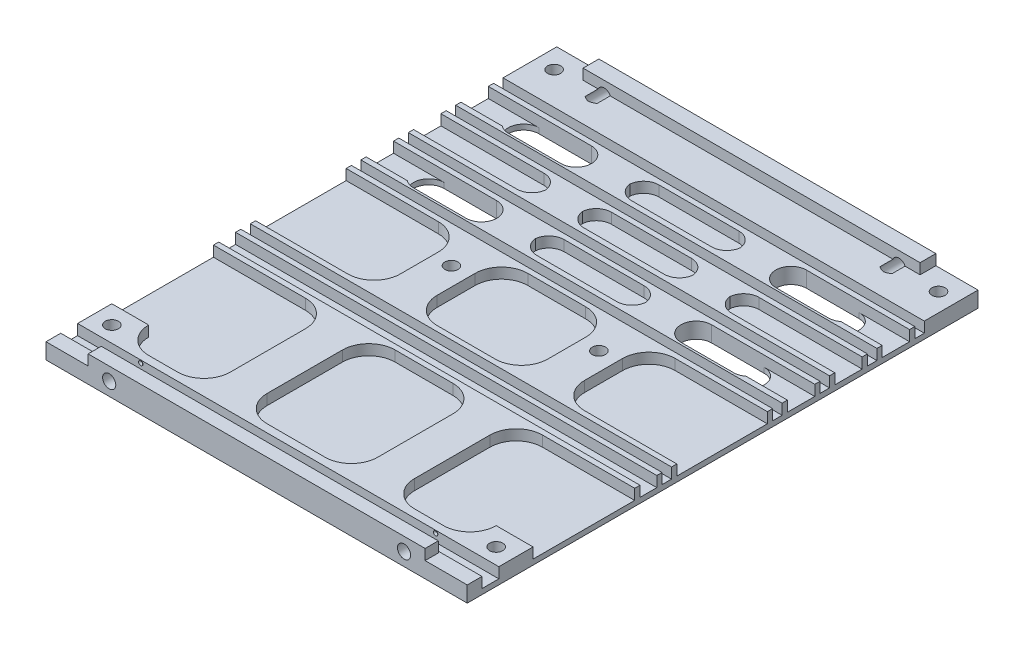
from build123d import *
from build123d.topology import SkipClean

# Parameters (mm, degrees)
SKETCH1_W                      = 80
SKETCH1_H                      = 97
BOSS_EXTRUDE1_DEPTH            = 1
SKETCH4_W                      = 80
SKETCH4_H                      = 1
BOSS_EXTRUDE2_DEPTH            = 2
LPATTERN1_COUNT                = 4
LPATTERN1_PITCH                = 9
MIRROR1_COPY_1_SKETCH_W        = 80
MIRROR1_COPY_1_SKETCH_H        = 1
MIRROR1_COPY_1_DEPTH           = 2
MIRROR1_COPY_2_SKETCH_W        = 80
MIRROR1_COPY_2_SKETCH_H        = 1
MIRROR1_COPY_2_DEPTH           = 2
MIRROR1_COPY_3_SKETCH_W        = 80
MIRROR1_COPY_3_SKETCH_H        = 1
MIRROR1_COPY_3_DEPTH           = 2
SKETCH10_W                     = 80
SKETCH10_H                     = 21.8
REMOVE_3_ROWS_DEPTH            = 63.898728127
SKETCH12_W                     = 80
SKETCH12_H                     = 1
SKETCH12_H_2                   = 1.5
PAYLOADSLOTS_DEPTH             = 2
BOSS_EXTRUDE8_DEPTH            = 2
SKETCH22_W                     = 80
SKETCH22_H                     = 9.2
SKETCH22_H_2                   = 2.5
BOSS_EXTRUDE9_DEPTH            = 4
FILLET4_R                      = 5
M3X0_5_TAPPED_HOLE2_AT_2_COUNT = 2
M3X0_5_TAPPED_HOLE2_AT_2_PITCH = 56
CUT_EXTRUDE1_REACH             = 65.065
SKETCH26_W                     = 8
SKETCH26_H                     = 2.5
SKETCH28_W                     = 7
SKETCH28_H                     = 5.2
SKETCH28_H_2                   = 24.3
BOSS_EXTRUDE10_DEPTH           = 2
FILLET5_R                      = 5
FILLET6_R                      = 2.9
SKETCH29_W                     = 7
SKETCH29_H                     = 5
BOSS_EXTRUDE11_DEPTH           = 2
FILLET7_R                      = 5
M3X0_5_TAPPED_HOLE1_D          = 2.5
CUT_EXTRUDE2_DEPTH             = 63.994047338
CUT_EXTRUDE2_DEPTH_BACK        = 63.994047338


# Some blends are built 0.0001 mm under size
with BuildPart() as part:
    # Sketch1 → Boss-Extrude1 (new body)
    with BuildSketch(Plane(origin=(0, 0, 0), x_dir=(1, 0, 0), z_dir=(0, 1, 0))):
        Rectangle(SKETCH1_W, SKETCH1_H)
    extrude(amount=BOSS_EXTRUDE1_DEPTH)

    # Sketch4 → Boss-Extrude2 (add)
    with BuildSketch(Plane(origin=(0, 1, 0), x_dir=(1, 0, 0), z_dir=(0, 1, 0))):
        with Locations((0, 38.8)):
            Rectangle(SKETCH4_W, SKETCH4_H)
        with Locations((0, 36)):
            Rectangle(SKETCH4_W, SKETCH4_H)
    boss_extrude2 = extrude(amount=BOSS_EXTRUDE2_DEPTH)

    # LPattern1: Boss-Extrude2 ×4
    with Locations(*[(0, 0, i * LPATTERN1_PITCH) for i in range(1, LPATTERN1_COUNT)]):
        add(boss_extrude2)

    # Mirror1: Boss-Extrude2 across plane
    add(boss_extrude2.mirror(Plane.XY.offset(0.1)))

    # Mirror1 copy 1 sketch → Mirror1 copy 1 (add)
    with BuildSketch(Plane(origin=(0, 1, -8.8), x_dir=(1, 0, 0), z_dir=(0, 1, 0))):
        with Locations((0, -38.8)):
            Rectangle(MIRROR1_COPY_1_SKETCH_W, MIRROR1_COPY_1_SKETCH_H)
        with Locations((0, -36)):
            Rectangle(MIRROR1_COPY_1_SKETCH_W, MIRROR1_COPY_1_SKETCH_H)
    extrude(amount=MIRROR1_COPY_1_DEPTH)

    # Mirror1 copy 2 sketch → Mirror1 copy 2 (add)
    with BuildSketch(Plane(origin=(0, 1, -17.8), x_dir=(1, 0, 0), z_dir=(0, 1, 0))):
        with Locations((0, -38.8)):
            Rectangle(MIRROR1_COPY_2_SKETCH_W, MIRROR1_COPY_2_SKETCH_H)
        with Locations((0, -36)):
            Rectangle(MIRROR1_COPY_2_SKETCH_W, MIRROR1_COPY_2_SKETCH_H)
    extrude(amount=MIRROR1_COPY_2_DEPTH)

    # Mirror1 copy 3 sketch → Mirror1 copy 3 (add)
    with BuildSketch(Plane(origin=(0, 1, -26.8), x_dir=(1, 0, 0), z_dir=(0, 1, 0))):
        with Locations((0, -38.8)):
            Rectangle(MIRROR1_COPY_3_SKETCH_W, MIRROR1_COPY_3_SKETCH_H)
        with Locations((0, -36)):
            Rectangle(MIRROR1_COPY_3_SKETCH_W, MIRROR1_COPY_3_SKETCH_H)
    extrude(amount=MIRROR1_COPY_3_DEPTH)

    # Sketch10 → Remove_3_rows (cut, through all)
    with BuildSketch(Plane(origin=(0, 1, 0), x_dir=(1, 0, 0), z_dir=(0, 1, 0))):
        with Locations((0, -28.6)):
            Rectangle(SKETCH10_W, SKETCH10_H)
    extrude(amount=REMOVE_3_ROWS_DEPTH, mode=Mode.SUBTRACT)

    # Sketch12 → PayloadSlots (add)
    with BuildSketch(Plane(origin=(0, 1, 0), x_dir=(1, 0, 0), z_dir=(0, 1, 0))):
        with Locations((0, -12)):
            Rectangle(SKETCH12_W, SKETCH12_H)
        with Locations((0, -16.2)):
            Rectangle(SKETCH12_W, SKETCH12_H)
        with Locations((0, -41.75)):
            Rectangle(SKETCH12_W, SKETCH12_H_2)
        with Locations((0, -46.45)):
            Rectangle(SKETCH12_W, SKETCH12_H_2)
    extrude(amount=PAYLOADSLOTS_DEPTH)

    # Sketch16 → Boss-Extrude8 (add)
    with BuildSketch(Plane(origin=(0, 1, 0), x_dir=(1, 0, 0), z_dir=(0, 1, 0))):
        with BuildLine():
            ThreePointArc((17.5, 2.5), (14, 6), (10.5, 2.5))
            Line((10.5, 2.5), (10.5, -8.7))
            Line((10.5, -8.7), (17.5, -8.7))
            Line((17.5, -8.7), (17.5, 2.5))
        make_face()
        with BuildLine():
            ThreePointArc((-10.5, 2.5), (-14, 6), (-17.5, 2.5))
            Line((-17.5, 2.5), (-17.5, -8.7))
            Line((-17.5, -8.7), (-10.5, -8.7))
            Line((-10.5, -8.7), (-10.5, 2.5))
        make_face()
    extrude(amount=BOSS_EXTRUDE8_DEPTH)

    # Sketch22 → Boss-Extrude9 (add)
    with BuildSketch(Plane(origin=(0, 1, 0), x_dir=(1, 0, 0), z_dir=(0, 1, 0))):
        with Locations((0, 43.9)):
            Rectangle(SKETCH22_W, SKETCH22_H)
        with Locations((0, -47.25)):
            Rectangle(SKETCH22_W, SKETCH22_H_2)
    extrude(amount=BOSS_EXTRUDE9_DEPTH)

    # Fillet4
    fillet4_edges = [part.edges().sort_by_distance(p)[0] for p in [
        (-10.5, 2, 8.7),
        (-17.5, 2, 8.7),
        (17.5, 2, 8.7),
        (10.5, 2, 8.7),
    ]]
    fillet(fillet4_edges, radius=FILLET4_R)

    # Sketch25 → M3x0.5 Tapped Hole2 (revolve, cut)
    with BuildSketch(Plane(origin=(28, 2.5, -48.5), x_dir=(0, 1, 0), z_dir=(1, 0, 0))):
        Polygon((0, 0), (0, 6.251075774), (1.25, 5.5), (1.25, 0), align=None)
    m3x0_5_tapped_hole2 = revolve(axis=Axis((28, 2.5, -54.85), (0, 0, 1)), mode=Mode.SUBTRACT)

    # M3x0.5 Tapped Hole2 at 2: M3x0.5 Tapped Hole2 ×2
    with Locations(*[(-i * M3X0_5_TAPPED_HOLE2_AT_2_PITCH, 0, 0) for i in range(1, M3X0_5_TAPPED_HOLE2_AT_2_COUNT)]):
        add(m3x0_5_tapped_hole2, mode=Mode.SUBTRACT)

    # Mirror2: M3x0.5 Tapped Hole2 across plane
    add(m3x0_5_tapped_hole2.mirror(Plane(origin=(0, 0, 0), x_dir=(1, 0, 0), z_dir=(0, 0, -1))), mode=Mode.SUBTRACT)

    # Mirror2 copy 1 sketch → Mirror2 copy 1 (revolve, cut)
    with BuildSketch(Plane(origin=(-28, 2.5, 48.5), x_dir=(0, 1, 0), z_dir=(1, 0, 0))):
        Polygon((0, 0), (0, -6.251075774), (1.25, -5.5), (1.25, 0), align=None)
    revolve(axis=Axis((-28, 2.5, 54.85), (0, 0, 1)), mode=Mode.SUBTRACT)

    # Cut-Extrude1: up to this face of the body (flat: up to its plane)
    cut_extrude1_end = Plane(part.part.faces().sort_by_distance((0, 3, -38.8))[0])
    # Sketch26 → Cut-Extrude1 (cut, up to the picked face)
    with BuildSketch(Plane(origin=(0, 5, 0), x_dir=(1, 0, 0), z_dir=(0, 1, 0)), mode=Mode.PRIVATE) as cut_extrude1_sk1:
        Polygon((-40, 39.3), (40, 39.3), (40, 48.5), (32, 48.5), (32, 45.5), (-32, 45.5), (-32, 48.5), (-40, 48.5), align=None)
    cut_extrude1_tool1 = split(extrude(cut_extrude1_sk1.sketch, amount=-CUT_EXTRUDE1_REACH, mode=Mode.PRIVATE), bisect_by=cut_extrude1_end, keep=Keep.BOTH, mode=Mode.PRIVATE)
    # Sketch26 → Cut-Extrude1 (cut, up to the picked face)
    with BuildSketch(Plane(origin=(0, 5, 0), x_dir=(1, 0, 0), z_dir=(0, 1, 0)), mode=Mode.PRIVATE) as cut_extrude1_sk2:
        with Locations((-36, -47.25)):
            Rectangle(SKETCH26_W, SKETCH26_H)
    cut_extrude1_tool2 = split(extrude(cut_extrude1_sk2.sketch, amount=-CUT_EXTRUDE1_REACH, mode=Mode.PRIVATE), bisect_by=cut_extrude1_end, keep=Keep.BOTH, mode=Mode.PRIVATE)
    # Sketch26 → Cut-Extrude1 (cut, up to the picked face)
    with BuildSketch(Plane(origin=(0, 5, 0), x_dir=(1, 0, 0), z_dir=(0, 1, 0)), mode=Mode.PRIVATE) as cut_extrude1_sk3:
        with Locations((36, -47.25)):
            Rectangle(SKETCH26_W, SKETCH26_H)
    cut_extrude1_tool3 = split(extrude(cut_extrude1_sk3.sketch, amount=-CUT_EXTRUDE1_REACH, mode=Mode.PRIVATE), bisect_by=cut_extrude1_end, keep=Keep.BOTH, mode=Mode.PRIVATE)
    add(cut_extrude1_tool1.solids().sort_by(Axis((0, 5, -42.805882), (0, -1, 0)))[0], mode=Mode.SUBTRACT)
    add(cut_extrude1_tool2.solids().sort_by(Axis((-36, 5, 47.25), (0, -1, 0)))[0], mode=Mode.SUBTRACT)
    add(cut_extrude1_tool3.solids().sort_by(Axis((36, 5, 47.25), (0, -1, 0)))[0], mode=Mode.SUBTRACT)

    # Sketch28 → Boss-Extrude10 (add)
    with BuildSketch(Plane(origin=(0, 1, 0), x_dir=(1, 0, 0), z_dir=(0, 1, 0))):
        with Locations((-14, 32.9)):
            Rectangle(SKETCH28_W, SKETCH28_H)
        with Locations((-14, 23.9)):
            Rectangle(SKETCH28_W, SKETCH28_H)
        with Locations((-14, 14.9)):
            Rectangle(SKETCH28_W, SKETCH28_H)
        with Locations((14, 23.9)):
            Rectangle(SKETCH28_W, SKETCH28_H)
        with Locations((14, 14.9)):
            Rectangle(SKETCH28_W, SKETCH28_H)
        with Locations((14, 32.9)):
            Rectangle(SKETCH28_W, SKETCH28_H)
        with BuildLine():
            Line((-10.5, 8.5), (-17.5, 8.5))
            Line((-17.5, 8.5), (-17.5, 2.5))
            ThreePointArc((-17.5, 2.5), (-14, 6), (-10.5, 2.5))
            Line((-10.5, 2.5), (-10.5, 8.5))
        make_face()
        with BuildLine():
            Line((17.5, 8.5), (10.5, 8.5))
            Line((10.5, 8.5), (10.5, 2.5))
            ThreePointArc((10.5, 2.5), (14, 6), (17.5, 2.5))
            Line((17.5, 2.5), (17.5, 8.5))
        make_face()
        with Locations((-14, -28.85)):
            Rectangle(SKETCH28_W, SKETCH28_H_2)
        with Locations((14, -28.85)):
            Rectangle(SKETCH28_W, SKETCH28_H_2)
    extrude(amount=BOSS_EXTRUDE10_DEPTH)

    # Fillet5
    fillet5_edges = [part.edges().sort_by_distance(p)[0] for p in [
        (-10.5, 2, 41),
        (-10.5, 2, 16.7),
        (-17.5, 2, 16.7),
        (-17.5, 2, 41),
        (-10.5, 2, -8.5),
        (-17.5, 2, -8.5),
        (10.5, 2, -8.5),
        (17.5, 2, -8.5),
        (10.5, 2, 16.7),
        (17.5, 2, 16.7),
        (17.5, 2, 41),
        (10.5, 2, 41),
    ]]
    fillet(fillet5_edges, radius=FILLET5_R)

    # Fillet6
    # the kernel refuses this fillet: 2.9 mm, written as the material it adds along each edge
    with BuildSketch(Plane(origin=(-10.5, 1, -17.5), x_dir=(1, 0, 0), z_dir=(0, 1, 0)), Plane(origin=(17.5, 1, -17.5), x_dir=(1, 0, 0), z_dir=(0, 1, 0)), Plane(origin=(17.5, 1, -26.5), x_dir=(1, 0, 0), z_dir=(0, 1, 0)), Plane(origin=(-10.5, 1, -26.5), x_dir=(1, 0, 0), z_dir=(0, 1, 0)), Plane(origin=(-10.5, 1, -35.5), x_dir=(1, 0, 0), z_dir=(0, 1, 0)), Plane(origin=(17.5, 1, -35.5), x_dir=(1, 0, 0), z_dir=(0, 1, 0)), Plane(origin=(-17.5, 1, -12.3), x_dir=(-1, 0, 0), z_dir=(0, 1, 0)), Plane(origin=(10.5, 1, -12.3), x_dir=(-1, 0, 0), z_dir=(0, 1, 0)), Plane(origin=(-17.5, 1, -21.3), x_dir=(-1, 0, 0), z_dir=(0, 1, 0)), Plane(origin=(10.5, 1, -21.3), x_dir=(-1, 0, 0), z_dir=(0, 1, 0)), Plane(origin=(10.5, 1, -30.3), x_dir=(-1, 0, 0), z_dir=(0, 1, 0)), Plane(origin=(10.5, 1, -17.5), x_dir=(0, 0, 1), z_dir=(0, 1, 0)), Plane(origin=(10.5, 1, -26.5), x_dir=(0, 0, 1), z_dir=(0, 1, 0)), Plane(origin=(10.5, 1, -35.5), x_dir=(0, 0, 1), z_dir=(0, 1, 0)), Plane(origin=(-17.5, 1, -17.5), x_dir=(0, 0, 1), z_dir=(0, 1, 0)), Plane(origin=(-17.5, 1, -26.5), x_dir=(0, 0, 1), z_dir=(0, 1, 0)), Plane(origin=(-17.5, 1, -35.5), x_dir=(0, 0, 1), z_dir=(0, 1, 0)), Plane(origin=(-17.5, 1, -30.3), x_dir=(-1, 0, 0), z_dir=(0, 1, 0))) as fillet6_piece_1:
        with BuildLine():
            CenterArc((FILLET6_R, -FILLET6_R), FILLET6_R, 90, 90)
            Line((0, -FILLET6_R), (0, 0))
            Line((0, 0), (FILLET6_R, 0))
        make_face()
    extrude(amount=2)
    with BuildSketch(Plane(origin=(17.5, 1, -30.3), x_dir=(1, 0, 0), z_dir=(0, 1, 0)), Plane(origin=(-10.5, 1, -30.3), x_dir=(1, 0, 0), z_dir=(0, 1, 0)), Plane(origin=(-10.5, 1, -21.3), x_dir=(1, 0, 0), z_dir=(0, 1, 0)), Plane(origin=(17.5, 1, -21.3), x_dir=(1, 0, 0), z_dir=(0, 1, 0)), Plane(origin=(17.5, 1, -12.3), x_dir=(1, 0, 0), z_dir=(0, 1, 0)), Plane(origin=(-10.5, 1, -12.3), x_dir=(1, 0, 0), z_dir=(0, 1, 0))) as fillet6_piece_2:
        with BuildLine():
            CenterArc((FILLET6_R, FILLET6_R), FILLET6_R, 180, 90)
            Line((0, FILLET6_R), (0, 0))
            Line((0, 0), (FILLET6_R, 0))
        make_face()
    extrude(amount=2)

    # Sketch29 → Boss-Extrude11 (add)
    with BuildSketch(Plane(origin=(0, 1, 0), x_dir=(1, 0, 0), z_dir=(0, 1, 0))):
        with Locations((36.5, -38.5)):
            Rectangle(SKETCH29_W, SKETCH29_H)
        with Locations((-36.5, -38.5)):
            Rectangle(SKETCH29_W, SKETCH29_H)
    extrude(amount=BOSS_EXTRUDE11_DEPTH)

    # Fillet7
    fillet7_edges = [part.edges().sort_by_distance(p)[0] for p in [
        (33, 2, 41),
        (-33, 2, 41),
    ]]
    fillet(fillet7_edges, radius=FILLET7_R - 0.0001)  # a hair under: the kernel refuses the full size

    # M3x0.5 Tapped Hole1 (through all)
    with Locations(Plane(origin=(0, 0, 0), x_dir=(-1, 0, 0), z_dir=(0, -1, 0))):
        with Locations((36.5, 44.5), (-36.5, 44.5), (14, 2.5), (-14, 2.5), (36.5, -39.5), (-36.5, -39.5)):
            Hole(M3X0_5_TAPPED_HOLE1_D / 2)

    # Sketch30 → Cut-Extrude2 (cut, two sides: drawn at the far end of the back side and taken through both)
    with SkipClean():  # the faces are left unmerged after this step: merging them gives an invalid solid
        with BuildSketch(Plane(origin=(0, 1, 0), x_dir=(1, 0, 0), z_dir=(0, 1, 0)).offset(-CUT_EXTRUDE2_DEPTH_BACK)):
            with BuildLine():
                Line((20.4, 17.5), (30.4, 17.5))
                ThreePointArc((30.4, 17.5), (33.3, 14.6), (30.4, 11.7))
                Line((30.4, 11.7), (20.4, 11.7))
                ThreePointArc((20.4, 11.7), (17.5, 14.6), (20.4, 17.5))
            make_face()
            with BuildLine():
                Line((20.4, 35.5), (30.4, 35.5))
                ThreePointArc((30.4, 35.5), (33.3, 32.6), (30.4, 29.7))
                Line((30.4, 29.7), (20.4, 29.7))
                ThreePointArc((20.4, 29.7), (17.5, 32.6), (20.4, 35.5))
            make_face()
            with BuildLine():
                Line((-20.4, 35.5), (-30.4, 35.5))
                ThreePointArc((-30.4, 35.5), (-33.3, 32.6), (-30.4, 29.7))
                Line((-30.4, 29.7), (-20.4, 29.7))
                ThreePointArc((-20.4, 29.7), (-17.5, 32.6), (-20.4, 35.5))
            make_face()
            with BuildLine():
                Line((-20.4, 17.5), (-30.4, 17.5))
                ThreePointArc((-30.4, 17.5), (-33.3, 14.6), (-30.4, 11.7))
                Line((-30.4, 11.7), (-20.4, 11.7))
                ThreePointArc((-20.4, 11.7), (-17.5, 14.6), (-20.4, 17.5))
            make_face()
        extrude(amount=CUT_EXTRUDE2_DEPTH + CUT_EXTRUDE2_DEPTH_BACK, mode=Mode.SUBTRACT)


solid = part.part
